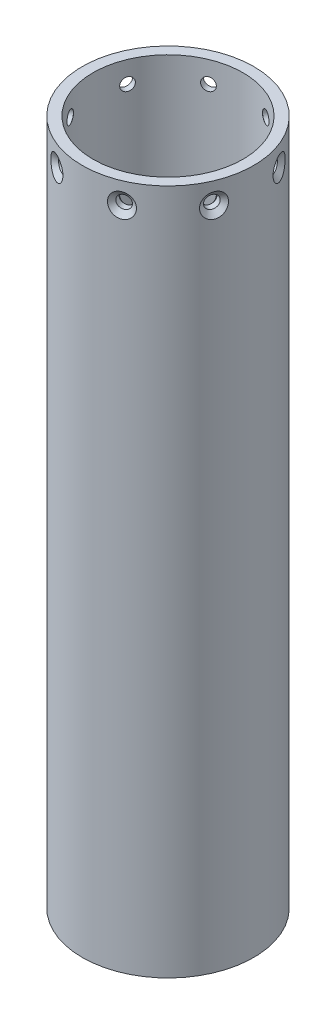
from build123d import *

# Parameters (mm, degrees)
SKETCH1_R              = 25.4
SKETCH1_R_2            = 22.225
BODY_DEPTH             = 203.2
TOP_BOLT_PATTERN_COUNT = 8


with BuildPart() as part:
    # Sketch1 → body (new body)
    with BuildSketch(Plane(origin=(0, 0, 0), x_dir=(1, 0, 0), z_dir=(0, 1, 0))):
        Circle(SKETCH1_R)
        Circle(SKETCH1_R_2, mode=Mode.SUBTRACT)
    extrude(amount=BODY_DEPTH)

    # Sketch4 → CSK for _6 Flat Head Machine Screw _100 (revolve, cut)
    with BuildSketch(Plane(origin=(9.720159182, 196.85, -23.466540126), x_dir=(-0.9238795325112865, 0, -0.3826834323650906), z_dir=(0, 1, 0))):
        Polygon((0, 0), (0, 4.315824014), (1.89865, 3.175), (1.89865, 1.380025208), (3.5433, 0), align=None)
    csk_for_6_flat_head_machine_screw_100 = revolve(axis=Axis((12.150198978, 196.85, -29.333175157), (-0.38268343236509056, 0, 0.9238795325112865)), mode=Mode.SUBTRACT)

    # top-bolt-pattern: CSK for _6 Flat Head Machine Screw _100 ×8 about axis
    top_bolt_pattern_axis = Axis((0, 203.2, 0), (0, -1, 0))
    for i in range(1, TOP_BOLT_PATTERN_COUNT):
        add(csk_for_6_flat_head_machine_screw_100.rotate(top_bolt_pattern_axis, i * 360 / TOP_BOLT_PATTERN_COUNT), mode=Mode.SUBTRACT)


solid = part.part
